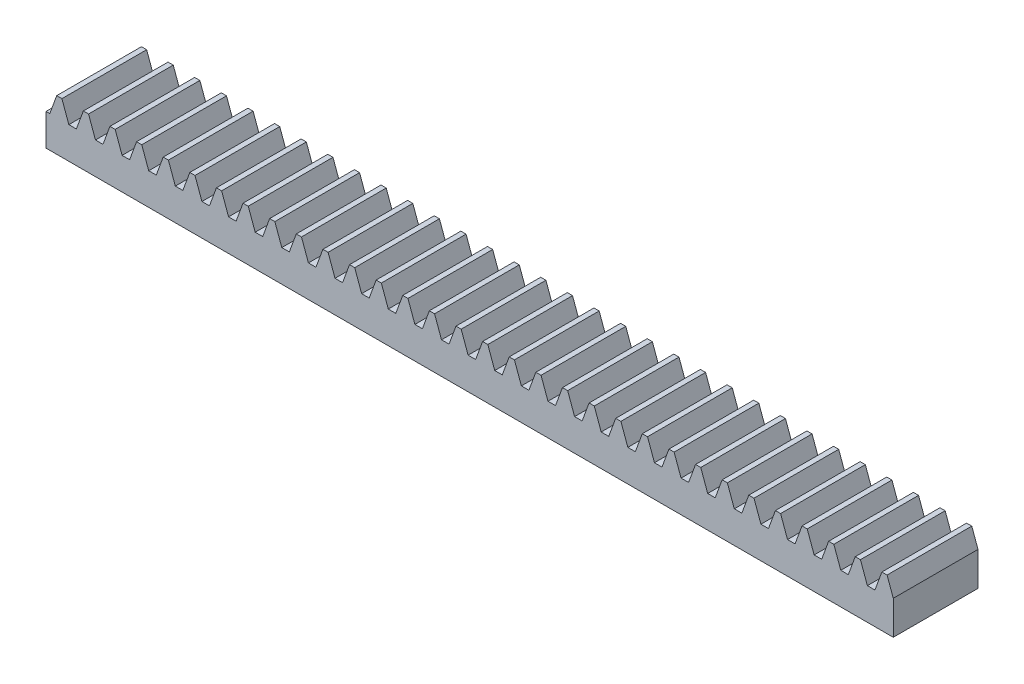
from build123d import *

# Parameters (mm, degrees)
BLANKSKE_W        = 100
BLANKSKE_H        = 6
BLANK_DEPTH       = 10
TOOTHCUTSIM_DEPTH = 101.677703589
TEETHCUTS_COUNT   = 33
TEETHCUTS_PITCH   = 3.14159265


with BuildPart() as part:
    # BlankSke → Blank (new body)
    with BuildSketch(Plane.XY):
        with Locations((50, 3)):
            Rectangle(BLANKSKE_W, BLANKSKE_H)
    extrude(amount=-BLANK_DEPTH)

    # TooCutSkeSim → ToothCutSim (cut, through all)
    with BuildSketch(Plane.XY):
        Polygon((0.44443537, 3.75), (-0.44443537, 3.75), (-1.272613241, 6.0254), (1.272613241, 6.0254), align=None)
    toothcutsim = extrude(amount=-TOOTHCUTSIM_DEPTH, mode=Mode.SUBTRACT)

    # TeethCuts: ToothCutSim ×33
    with Locations(*[(i * TEETHCUTS_PITCH, 0, 0) for i in range(1, TEETHCUTS_COUNT)]):
        add(toothcutsim, mode=Mode.SUBTRACT)


solid = part.part
